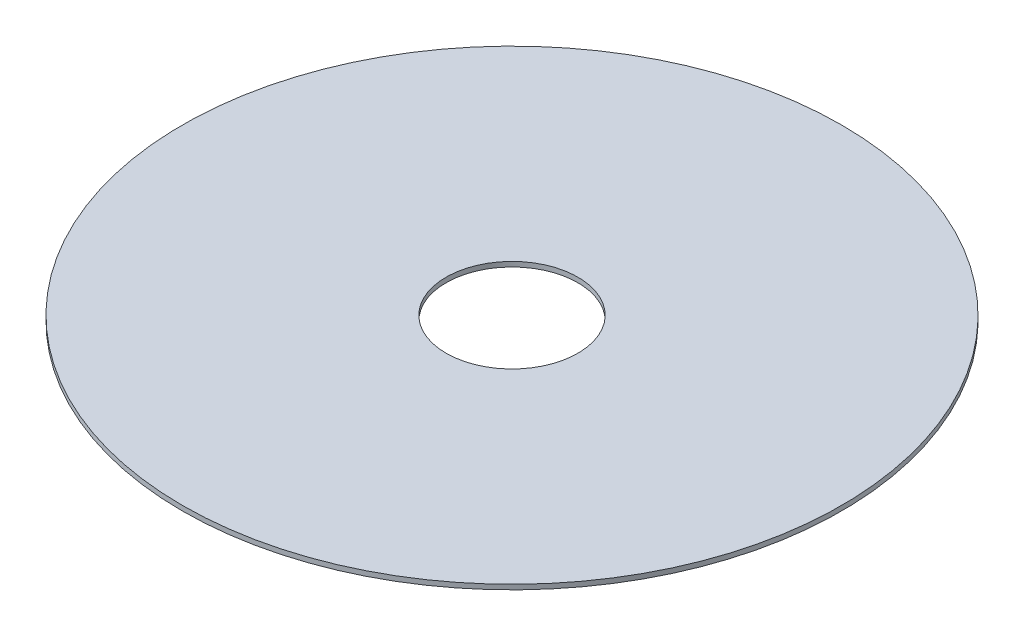
from build123d import *

# Parameters (mm, degrees)
SKETCH1_R          = 50
SKETCH1_R_2        = 10
BASE_FLANGE1_DEPTH = 0.7366


# Sheet-metal steps are written as plain solids
with BuildPart() as part:
    # Sketch1 → Base-Flange1 (new body)
    with BuildSketch(Plane(origin=(0, 0, 0), x_dir=(1, 0, 0), z_dir=(0, 1, 0))):
        with Locations(Location((0, 0, 0), (0, 0, 270))):
            Circle(SKETCH1_R)
        with Locations(Location((0, 0, 0), (0, 0, 270))):
            Circle(SKETCH1_R_2, mode=Mode.SUBTRACT)
    extrude(amount=-BASE_FLANGE1_DEPTH)


solid = part.part
